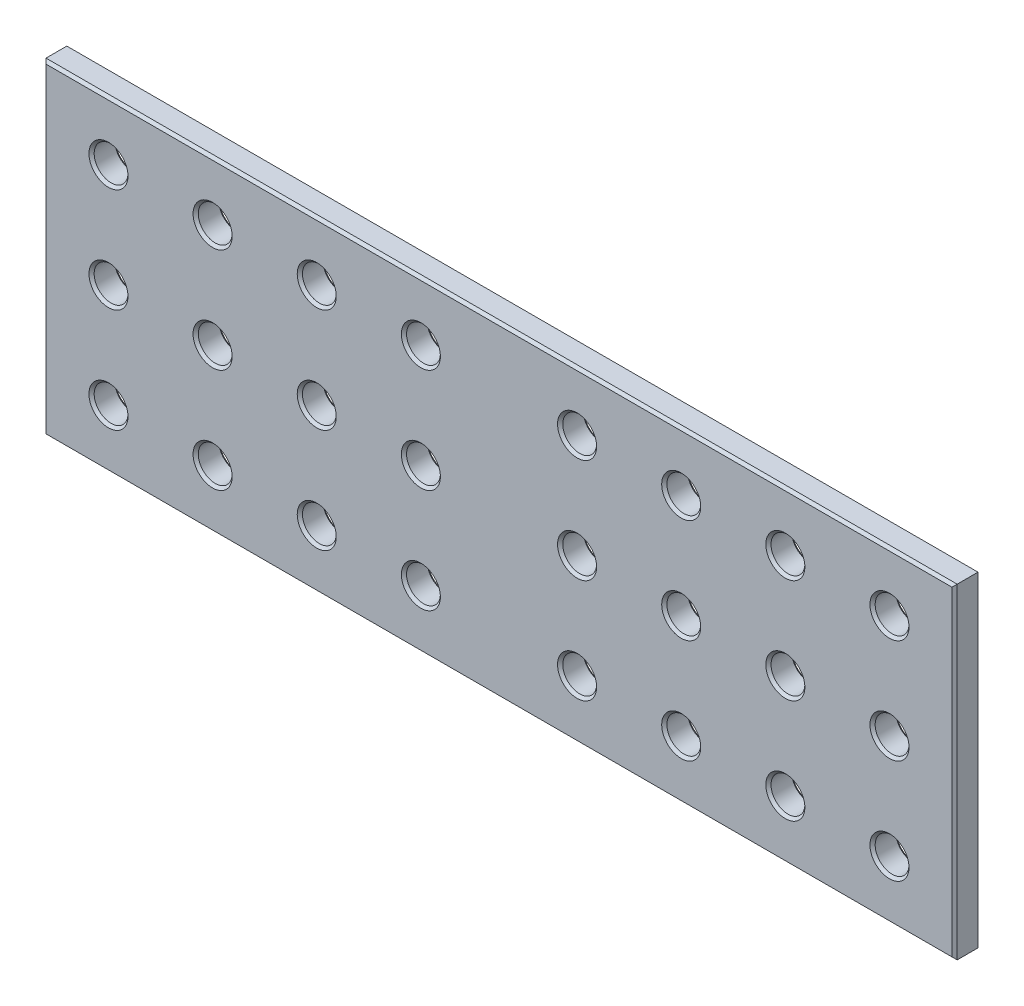
from build123d import *

# Parameters (mm, degrees)
SKETCH_1_W        = 700
SKETCH_1_H        = 250
SKETCH_1_R        = 13
EXTRUDE_626_DEPTH = 20
CHAMFER_1_SIZE    = 2


with BuildPart() as part:
    # 草图1 → Extrude 626 (new body)
    with BuildSketch(Plane.XY):
        Rectangle(SKETCH_1_W, SKETCH_1_H)
        with Locations((-300, 80)):
            Circle(SKETCH_1_R, mode=Mode.SUBTRACT)
        with Locations((-220, 80)):
            Circle(SKETCH_1_R, mode=Mode.SUBTRACT)
        with Locations((-140, 80)):
            Circle(SKETCH_1_R, mode=Mode.SUBTRACT)
        with Locations((-60, 80)):
            Circle(SKETCH_1_R, mode=Mode.SUBTRACT)
        with Locations((-60, 0)):
            Circle(SKETCH_1_R, mode=Mode.SUBTRACT)
        with Locations((-220, 0)):
            Circle(SKETCH_1_R, mode=Mode.SUBTRACT)
        with Locations((-300, 0)):
            Circle(SKETCH_1_R, mode=Mode.SUBTRACT)
        with Locations((-140, 0)):
            Circle(SKETCH_1_R, mode=Mode.SUBTRACT)
        with Locations((-60, -80)):
            Circle(SKETCH_1_R, mode=Mode.SUBTRACT)
        with Locations((-140, -80)):
            Circle(SKETCH_1_R, mode=Mode.SUBTRACT)
        with Locations((-220, -80)):
            Circle(SKETCH_1_R, mode=Mode.SUBTRACT)
        with Locations((-300, -80)):
            Circle(SKETCH_1_R, mode=Mode.SUBTRACT)
        with Locations((300, -80)):
            Circle(SKETCH_1_R, mode=Mode.SUBTRACT)
        with Locations((220, -80)):
            Circle(SKETCH_1_R, mode=Mode.SUBTRACT)
        with Locations((140, -80)):
            Circle(SKETCH_1_R, mode=Mode.SUBTRACT)
        with Locations((60, -80)):
            Circle(SKETCH_1_R, mode=Mode.SUBTRACT)
        with Locations((140, 0)):
            Circle(SKETCH_1_R, mode=Mode.SUBTRACT)
        with Locations((300, 0)):
            Circle(SKETCH_1_R, mode=Mode.SUBTRACT)
        with Locations((220, 0)):
            Circle(SKETCH_1_R, mode=Mode.SUBTRACT)
        with Locations((60, 0)):
            Circle(SKETCH_1_R, mode=Mode.SUBTRACT)
        with Locations((60, 80)):
            Circle(SKETCH_1_R, mode=Mode.SUBTRACT)
        with Locations((140, 80)):
            Circle(SKETCH_1_R, mode=Mode.SUBTRACT)
        with Locations((220, 80)):
            Circle(SKETCH_1_R, mode=Mode.SUBTRACT)
        with Locations((300, 80)):
            Circle(SKETCH_1_R, mode=Mode.SUBTRACT)
    extrude(amount=EXTRUDE_626_DEPTH)

    # 倒角1
    chamfer_1_edges = [part.edges().sort_by_distance(p)[0] for p in [
        (287, 80, 0),
        (127, 80, 0),
        (47, 0, 0),
        (287, 0, 0),
        (47, -80, 0),
        (207, -80, 0),
        (-313, -80, 0),
        (-153, -80, 0),
        (-153, 0, 0),
        (-233, 0, 0),
        (-73, 80, 0),
        (-233, 80, 0),
        (0, -125, 0),
        (350, 0, 0),
        (0, 125, 0),
        (-350, 0, 0),
        (-313, 80, 0),
        (-153, 80, 0),
        (-73, 0, 0),
        (-313, 0, 0),
        (-73, -80, 0),
        (-233, -80, 0),
        (287, -80, 0),
        (127, -80, 0),
        (127, 0, 0),
        (207, 0, 0),
        (47, 80, 0),
        (207, 80, 0),
        (287, 80, 20),
        (127, 80, 20),
        (47, 0, 20),
        (287, 0, 20),
        (47, -80, 20),
        (207, -80, 20),
        (-313, -80, 20),
        (-153, -80, 20),
        (-153, 0, 20),
        (-233, 0, 20),
        (-73, 80, 20),
        (-233, 80, 20),
        (0, 125, 20),
        (350, 0, 20),
        (0, -125, 20),
        (-350, 0, 20),
        (-313, 80, 20),
        (-153, 80, 20),
        (-73, 0, 20),
        (-313, 0, 20),
        (-73, -80, 20),
        (-233, -80, 20),
        (287, -80, 20),
        (127, -80, 20),
        (127, 0, 20),
        (207, 0, 20),
        (47, 80, 20),
        (207, 80, 20),
    ]]
    chamfer(chamfer_1_edges, length=CHAMFER_1_SIZE)


solid = part.part
